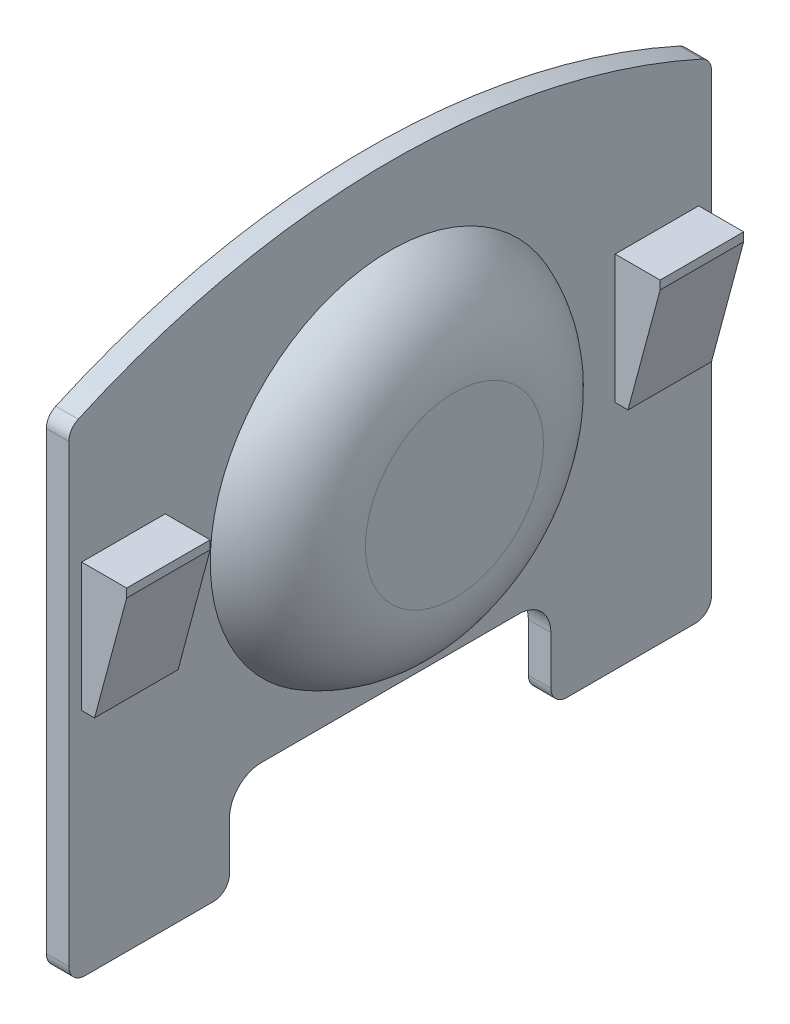
from build123d import *
from OCP.BRepFilletAPI import BRepFilletAPI_MakeChamfer

# Parameters (mm, degrees)
SKETCH1_R           = 2.8
BOSS_EXTRUDE1_DEPTH = 1
BOSS_EXTRUDE2_DEPTH = 0.35
FILLET1_R           = 1.5
SKETCH3_W           = 1.3
SKETCH3_H           = 2
BOSS_EXTRUDE3_DEPTH = 0.7
CHAMFER1_SIZE       = 0.5
CHAMFER1_SIZE2      = 1.866025404
FILLET2_R           = 0.5
FILLET3_R           = 0.25
SHELL3_START        = -4.45
SHELL3_DEPTH        = 0.6
SHELL3_START_2      = 3.85
SHELL3_2_DEPTH      = 0.6


# Read off the part's stored shape, not the designer's step: Shell3
with BuildPart() as part:
    # Sketch1 → Boss-Extrude1 (new body)
    with BuildSketch(Plane(origin=(0, 0, 0), x_dir=(0, 0, -1), z_dir=(1, 0, 0))):
        Circle(SKETCH1_R)
    extrude(amount=BOSS_EXTRUDE1_DEPTH)

    # Sketch2 → Boss-Extrude2 (add)
    with BuildSketch(Plane(origin=(0, 0, 0), x_dir=(0, 0, -1), z_dir=(1, 0, 0))):
        with BuildLine():
            Line((2.5, -4.6), (5, -4.6))
            Line((5, -4.6), (5, 2.495381949))
            Line((5, 2.495381949), (5, 2.884339454))
            ThreePointArc((5, 2.884339454), (0, 4), (-5, 2.884339454))
            Line((-5, 2.884339454), (-5, 2.495381949))
            Line((-5, 2.495381949), (-5, -4.6))
            Line((-5, -4.6), (-2.5, -4.6))
            Line((-2.5, -4.6), (-2.5, -3.1))
            Line((-2.5, -3.1), (2.5, -3.1))
            Line((2.5, -3.1), (2.5, -4.6))
        make_face()
    extrude(amount=-BOSS_EXTRUDE2_DEPTH)

    # Fillet1
    # the kernel refuses this fillet: 1.5 mm, written as the material it takes off along each edge
    with BuildSketch(Plane(origin=(1, 0, 0), x_dir=(0, 0, -1), z_dir=(0, -1, 0))) as fillet1_piece_1:
        with BuildLine():
            CenterArc((1.385786438, -1.5), FILLET1_R, 19.471220634, 70.528779366)
            Line((1.385786438, 0), (1.385786438, 0.03))
            Line((1.385786438, 0.03), (2.8, 0.03))
            Line((2.8, 0.03), (2.83, 0))
            ThreePointArc((2.83, 0), (2.83, -0.5), (2.828284271, -0.99))
            Line((2.828284271, -0.99), (2.8, -1))
        make_face()
    revolve(axis=Axis((1, 0, 0), (1, 0, 0)), mode=Mode.SUBTRACT)

    # Sketch3 → Boss-Extrude3 (add)
    with BuildSketch(Plane(origin=(0, 0, 0), x_dir=(0, 0, -1), z_dir=(1, 0, 0))):
        with Locations((-4.15, 0)):
            Rectangle(SKETCH3_W, SKETCH3_H)
        with Locations((4.15, 0)):
            Rectangle(SKETCH3_W, SKETCH3_H)
    extrude(amount=BOSS_EXTRUDE3_DEPTH)

    # Chamfer1: one chamfer whose edges measure the first distance from different faces: ONE call of the kernel's chamfer builder (chamfer() names one face for all edges)
    chamfer1_edges_1 = [part.edges().sort_by_distance(p)[0] for p in [
        (0.7, -1, 4.15),
    ]]
    chamfer1_side_1 = [part.faces().sort_by_distance(p)[0] for p in [
        (0.35, -1, 4.15),
    ]]
    chamfer1_edges_2 = [part.edges().sort_by_distance(p)[0] for p in [
        (0.7, -1, -4.15),
    ]]
    chamfer1_side_2 = [part.faces().sort_by_distance(p)[0] for p in [
        (0.35, -1, -4.15),
    ]]
    chamfer1 = BRepFilletAPI_MakeChamfer(part.part.solid().wrapped)
    for e in chamfer1_edges_1:
        chamfer1.Add(CHAMFER1_SIZE, CHAMFER1_SIZE2, e.wrapped, chamfer1_side_1[0].wrapped)  # the first distance lies on this face
    for e in chamfer1_edges_2:
        chamfer1.Add(CHAMFER1_SIZE, CHAMFER1_SIZE2, e.wrapped, chamfer1_side_2[0].wrapped)  # the first distance lies on this face
    add(Compound.cast(chamfer1.Shape()), mode=Mode.REPLACE)

    # Fillet2
    fillet2_edges = [part.edges().sort_by_distance(p)[0] for p in [
        (-0.175, -3.1, 2.5),
        (-0.175, -3.1, -2.5),
    ]]
    fillet(fillet2_edges, radius=FILLET2_R)

    # Fillet3
    fillet3_edges = [part.edges().sort_by_distance(p)[0] for p in [
        (-0.175, -4.6, 2.5),
        (-0.175, -4.6, 5),
        (-0.175, 2.884339454, 5),
        (-0.175, 2.884339454, -5),
        (-0.175, -4.6, -5),
        (-0.175, -4.6, -2.5),
    ]]
    fillet(fillet3_edges, radius=FILLET3_R)

    # Shell3 outline → Shell3 (cut)
    with BuildSketch(Plane.XY.offset(SHELL3_START)):
        Polygon((-0.35, -0.65), (-0.068564446, -0.65), (0.279769504, 0.65), (-0.35, 0.65), align=None)
    extrude(amount=SHELL3_DEPTH, mode=Mode.SUBTRACT)

    # Shell3 2 outline → Shell3 2 (cut)
    with BuildSketch(Plane.XY.offset(SHELL3_START_2)):
        Polygon((-0.35, -0.65), (-0.068564446, -0.65), (0.279769504, 0.65), (-0.35, 0.65), align=None)
    extrude(amount=SHELL3_2_DEPTH, mode=Mode.SUBTRACT)

    # Shell3 3 outline → Shell3 3 (revolve, cut)
    with BuildSketch(Plane.YX):
        with BuildLine():
            ThreePointArc((2.525961863, -0.35), (2.144073982, 0.364580823), (1.385786438, 0.65))
            Line((1.385786438, 0.65), (0, 0.65))
            Line((0, 0.65), (0, -0.35))
            Line((0, -0.35), (2.525961863, -0.35))
        make_face()
    revolve(axis=Axis((0, 0, 0), (1, 0, 0)), mode=Mode.SUBTRACT)


solid = part.part
